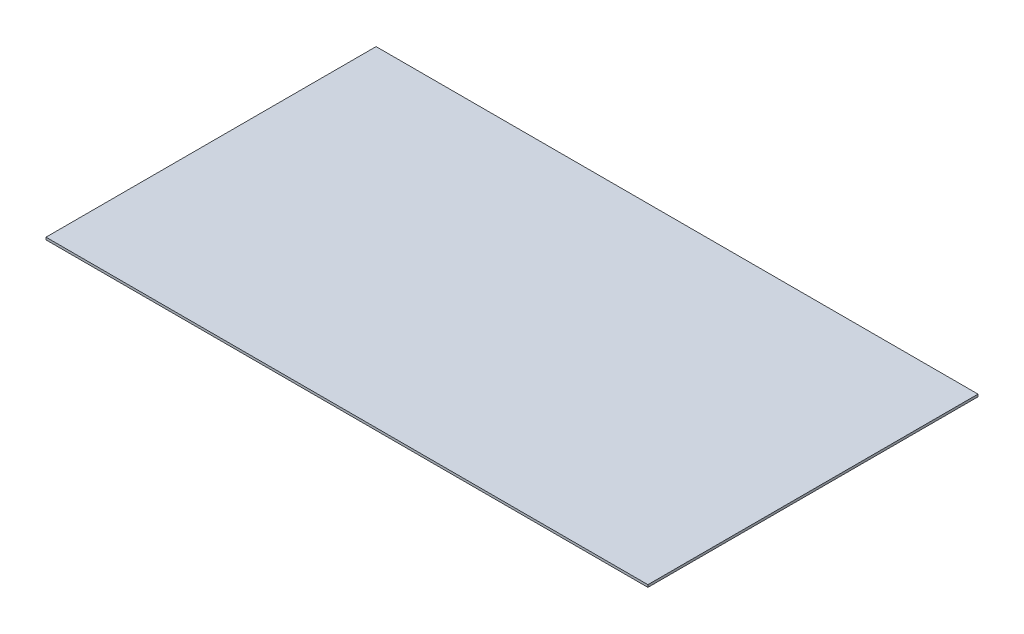
from build123d import *

# Parameters (mm, degrees)
SKETCH1_W           = 758.67
SKETCH1_H           = 416.052
BOSS_EXTRUDE1_DEPTH = 3


with BuildPart() as part:
    # Sketch1 → Boss-Extrude1 (new body)
    with BuildSketch(Plane(origin=(0, 0, 0), x_dir=(1, 0, 0), z_dir=(0, 1, 0))):
        Rectangle(SKETCH1_W, SKETCH1_H)
    extrude(amount=BOSS_EXTRUDE1_DEPTH)


solid = part.part
